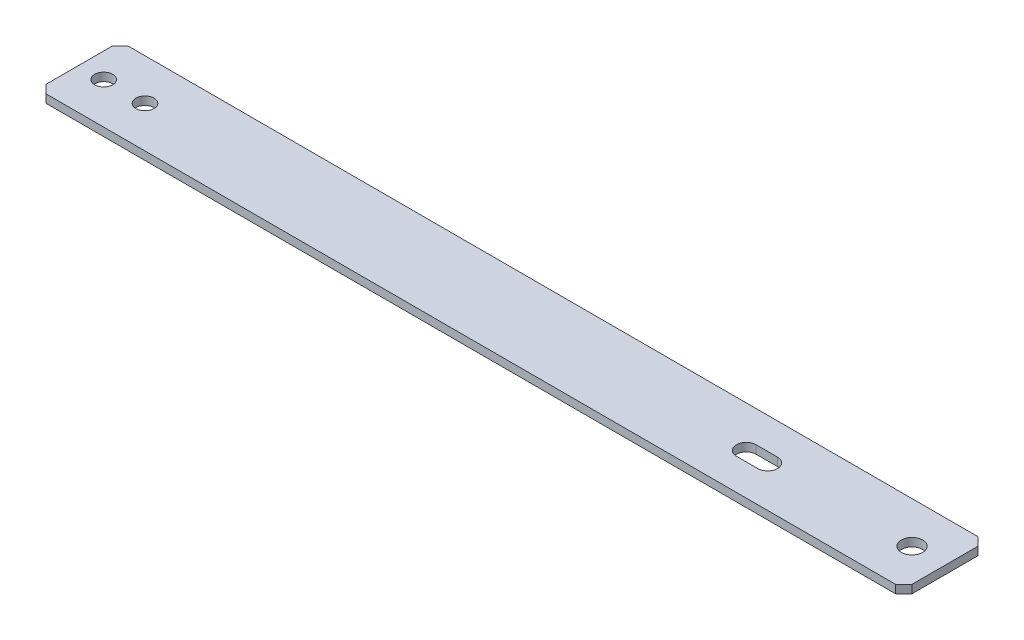
from build123d import *

# Parameters (mm, degrees)
SKETCH_1_W             = 525
SKETCH_1_H             = 5
SM_BASE_FLANGE_1_DEPTH = 50
SKETCH_6_R             = 5.5
CUT_EXTRUDE_1_DEPTH    = 10
CUT_EXTRUDE_2_DEPTH    = 10
SKETCH_8_R             = 6.5
CUT_EXTRUDE_3_DEPTH    = 10
OTHER_START            = -5
OTHER_1_DEPTH          = 5


# Read off the part's stored shape, not the designer's step: Затупленный угол1
# Sheet-metal steps are written as plain solids
with BuildPart() as part:
    # Sketch 1 → Базовая кромка1 (new body)
    with BuildSketch(Plane.XY):
        with Locations((55.681818182, -2.5)):
            Rectangle(SKETCH_1_W, SKETCH_1_H)
    extrude(amount=SM_BASE_FLANGE_1_DEPTH)

    # Эскиз6 → Вырез-Вытянуть1 (cut)
    with BuildSketch(Plane(origin=(0, 0, 0), x_dir=(1, 0, 0), z_dir=(0, 1, 0))):
        with Locations(Location((-191.818181818, -25, 0), (0, 0, 270))):
            Circle(SKETCH_6_R)
        with Locations(Location((-166.818181818, -25, 0), (0, 0, 270))):
            Circle(SKETCH_6_R)
    extrude(amount=-CUT_EXTRUDE_1_DEPTH, mode=Mode.SUBTRACT)

    # Эскиз7 → Вырез-Вытянуть2 (cut)
    with BuildSketch(Plane(origin=(0, 0, 0), x_dir=(1, 0, 0), z_dir=(0, 1, 0))):
        with BuildLine():
            Line((197.681818182, -19), (210.681818182, -19))
            ThreePointArc((210.681818182, -19), (216.681818182, -25), (210.681818182, -31))
            Line((210.681818182, -31), (197.681818182, -31))
            ThreePointArc((197.681818182, -31), (191.681818182, -25), (197.681818182, -19))
        make_face()
    extrude(amount=-CUT_EXTRUDE_2_DEPTH, mode=Mode.SUBTRACT)

    # Эскиз8 → Вырез-Вытянуть3 (cut)
    with BuildSketch(Plane(origin=(0, 0, 0), x_dir=(1, 0, 0), z_dir=(0, 1, 0))):
        with Locations(Location((298.181818182, -25, 0), (0, 0, 270))):
            Circle(SKETCH_8_R)
    extrude(amount=-CUT_EXTRUDE_3_DEPTH, mode=Mode.SUBTRACT)

    # Other 1 outline → Other 1 (cut)
    with BuildSketch(Plane(origin=(0, 0, 0), x_dir=(1, 0, 0), z_dir=(0, 1, 0)).offset(OTHER_START)):
        Polygon((318.181818182, 0), (313.181818182, 0), (318.181818182, -5), align=None)
        Polygon((-206.818181818, -5), (-201.818181818, 0), (-206.818181818, 0), align=None)
        Polygon((318.181818182, -50), (318.181818182, -45), (313.181818182, -50), align=None)
        Polygon((-201.818181818, -50), (-206.818181818, -45), (-206.818181818, -50), align=None)
    extrude(amount=OTHER_1_DEPTH, mode=Mode.SUBTRACT)


solid = part.part
